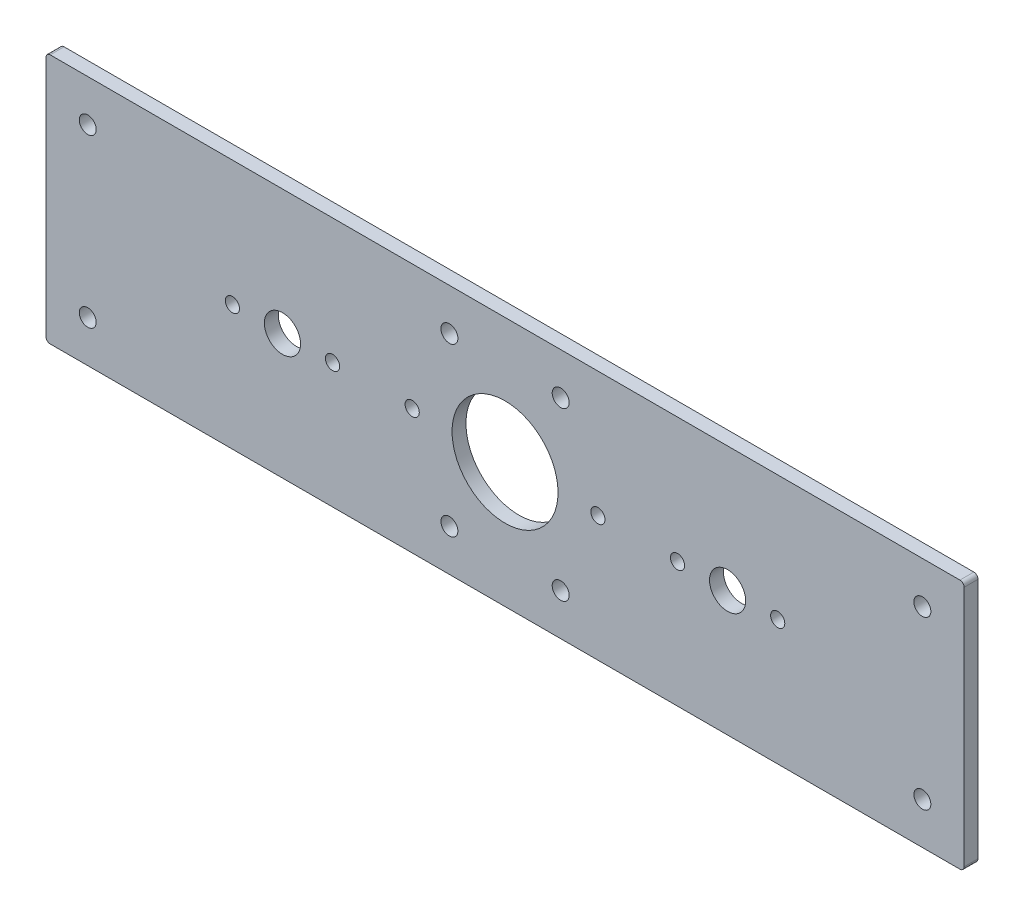
from build123d import *

# Parameters (mm, degrees)
SKETCH1_W           = 330
SKETCH1_H           = 90
SKETCH1_R           = 19.05
SKETCH1_R_2         = 2.55
BOSS_EXTRUDE1_DEPTH = 2.5
SKETCH2_R           = 3.05
CUT_EXTRUDE1_DEPTH  = 172.099386323
SKETCH3_R           = 2.55
SKETCH3_R_2         = 6.5
CUT_EXTRUDE2_DEPTH  = 172.099386323
FILLET1_R           = 1.5


with BuildPart() as part:
    # Sketch1 → Boss-Extrude1 (new, symmetric)
    with BuildSketch(Plane.XY):
        Rectangle(SKETCH1_W, SKETCH1_H)
        Circle(SKETCH1_R, mode=Mode.SUBTRACT)
        with Locations((-33.375440072, 0)):
            Circle(SKETCH1_R_2, mode=Mode.SUBTRACT)
        with Locations((33.375440072, 0)):
            Circle(SKETCH1_R_2, mode=Mode.SUBTRACT)
    extrude(amount=BOSS_EXTRUDE1_DEPTH, both=True)

    # Sketch2 → Cut-Extrude1 (cut, through all)
    with BuildSketch(Plane.XY.offset(2.5)):
        with Locations((-150, 30)):
            Circle(SKETCH2_R)
        with Locations((-150, -30)):
            Circle(SKETCH2_R)
        with Locations((-20, 30)):
            Circle(SKETCH2_R)
        with Locations((-20, -30)):
            Circle(SKETCH2_R)
        with Locations((20, -30)):
            Circle(SKETCH2_R)
        with Locations((20, 30)):
            Circle(SKETCH2_R)
        with Locations((150, 30)):
            Circle(SKETCH2_R)
        with Locations((150, -30)):
            Circle(SKETCH2_R)
    extrude(amount=-CUT_EXTRUDE1_DEPTH, mode=Mode.SUBTRACT)

    # Sketch3 → Cut-Extrude2 (cut, through all)
    with BuildSketch(Plane.XY.offset(2.5)):
        with Locations((-62, 0)):
            Circle(SKETCH3_R)
        with Locations((-98, 0)):
            Circle(SKETCH3_R)
        with Locations((-80, 0)):
            Circle(SKETCH3_R_2)
    cut_extrude2 = extrude(amount=-CUT_EXTRUDE2_DEPTH, mode=Mode.SUBTRACT)

    # Mirror1: Cut-Extrude2 across plane
    add(cut_extrude2.mirror(Plane(origin=(0, 0, 0), x_dir=(0, 0, 1), z_dir=(1, 0, 0))), mode=Mode.SUBTRACT)

    # Fillet1
    fillet1_edges = [part.edges().sort_by_distance(p)[0] for p in [
        (-165, -45, 0),
        (165, -45, 0),
        (165, 45, 0),
        (-165, 45, 0),
    ]]
    fillet(fillet1_edges, radius=FILLET1_R)


solid = part.part
